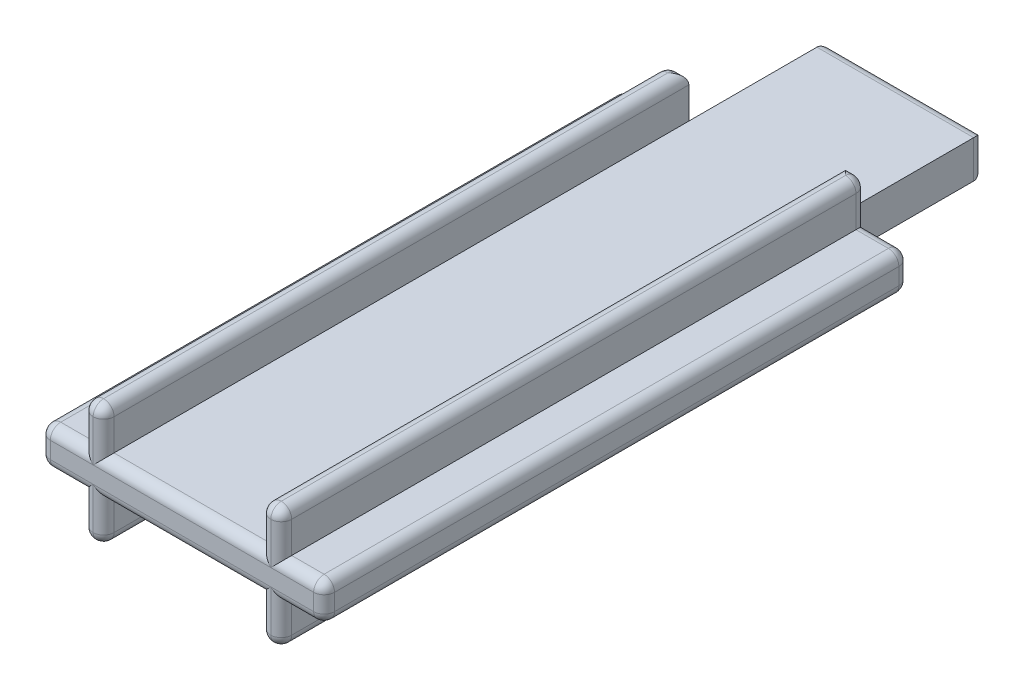
from build123d import *

# Parameters (mm, degrees)
AUFSATZ_LINEAR_AUSTRAGEN1_DEPTH = 28
SKIZZE2_W                       = 7.5
SKIZZE2_H                       = 1.8
AUFSATZ_LINEAR_AUSTRAGEN2_DEPTH = 6.63
VERRUNDUNG1_R                   = 0.5


with BuildPart() as part:
    # Skizze1 → Aufsatz-Linear austragen1 (new body)
    with BuildSketch(Plane.XY):
        Polygon((-4.75, 0.9), (-6.8, 0.9), (-6.8, -0.9), (-4.75, -0.9), (-4.75, -2.9), (-3.75, -2.9), (-3.75, -0.9), (3.75, -0.9), (3.75, -2.9), (4.75, -2.9), (4.75, -0.9), (6.8, -0.9), (6.8, 0.9), (4.75, 0.9), (4.75, 2.9), (3.75, 2.9), (3.75, 0.9), (-3.75, 0.9), (-3.75, 2.9), (-4.75, 2.9), align=None)
    extrude(amount=AUFSATZ_LINEAR_AUSTRAGEN1_DEPTH)

    # Skizze2 → Aufsatz-Linear austragen2 (add)
    with BuildSketch(Plane(origin=(0, 0, 0), x_dir=(-1, 0, 0), z_dir=(0, 0, -1))):
        Rectangle(SKIZZE2_W, SKIZZE2_H)
    extrude(amount=AUFSATZ_LINEAR_AUSTRAGEN2_DEPTH)

    # Verrundung1
    verrundung1_edges = [part.edges().sort_by_distance(p)[0] for p in [
        (-4.75, -1.9, 28),
        (-4.25, -2.9, 28),
        (-5.775, 0.9, 0),
        (-4.75, 1.9, 0),
        (-4.25, 2.9, 0),
        (-3.75, -1.9, 28),
        (4.25, 2.9, 0),
        (4.75, 1.9, 0),
        (5.775, 0.9, 0),
        (6.8, 0, 0),
        (5.775, -0.9, 0),
        (4.75, -1.9, 0),
        (4.25, -2.9, 0),
        (0, -0.9, 28),
        (-4.25, -2.9, 0),
        (-4.75, -1.9, 0),
        (-5.775, -0.9, 0),
        (-6.8, 0, 0),
        (3.75, -1.9, 28),
        (4.25, -2.9, 28),
        (-6.8, 0.9, 14),
        (-4.75, 2.9, 14),
        (-3.75, 2.9, 14),
        (3.75, 2.9, 14),
        (4.75, 2.9, 14),
        (6.8, 0.9, 14),
        (6.8, -0.9, 14),
        (4.75, -2.9, 14),
        (3.75, -2.9, 14),
        (-3.75, -2.9, 14),
        (-4.75, -2.9, 14),
        (-6.8, -0.9, 14),
        (4.75, -1.9, 28),
        (5.775, -0.9, 28),
        (6.8, 0, 28),
        (5.775, 0.9, 28),
        (-6.8, 0, 28),
        (4.75, 1.9, 28),
        (4.25, 2.9, 28),
        (3.75, 0, -6.63),
        (0, -0.9, -6.63),
        (-3.75, 0, -6.63),
        (0, 0.9, -6.63),
        (3.75, 1.9, 28),
        (0, 0.9, 28),
        (-3.75, 1.9, 28),
        (-4.25, 2.9, 28),
        (-4.75, 1.9, 28),
        (-5.775, 0.9, 28),
        (-5.775, -0.9, 28),
    ]]
    fillet(verrundung1_edges, radius=VERRUNDUNG1_R - 0.0001)  # a hair under: the kernel refuses the full size


solid = part.part
